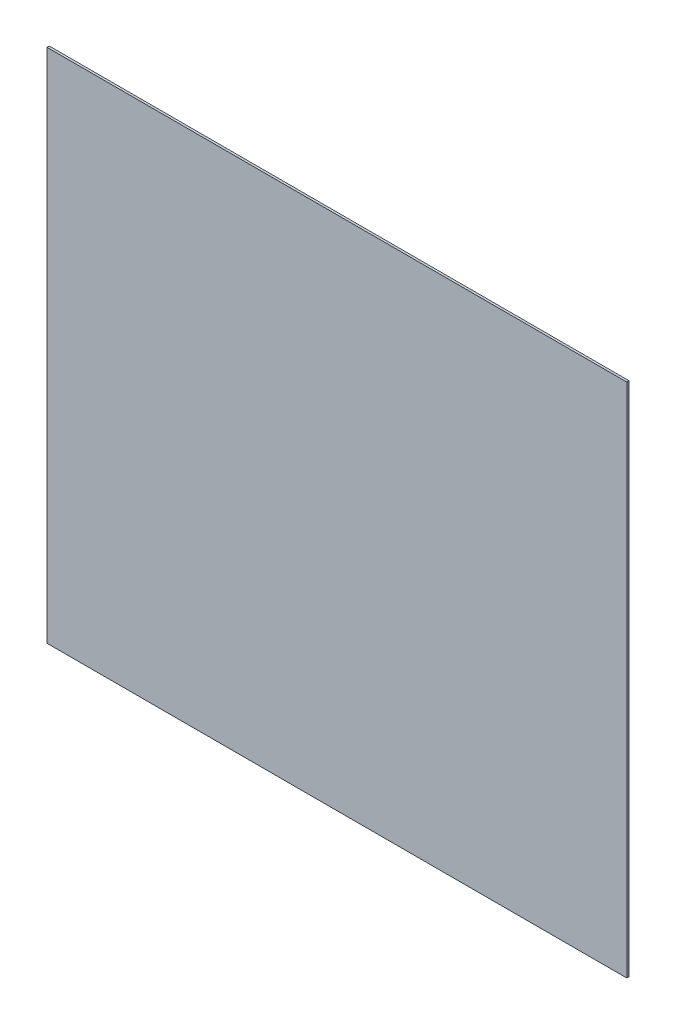
from build123d import *

# Parameters (mm, degrees)
SKETCH1_W           = 820
SKETCH1_H           = 730
BOSS_EXTRUDE1_DEPTH = 3.175


with BuildPart() as part:
    # Sketch1 → Boss-Extrude1 (new body)
    with BuildSketch(Plane.XY):
        Rectangle(SKETCH1_W, SKETCH1_H)
    extrude(amount=BOSS_EXTRUDE1_DEPTH)


solid = part.part
